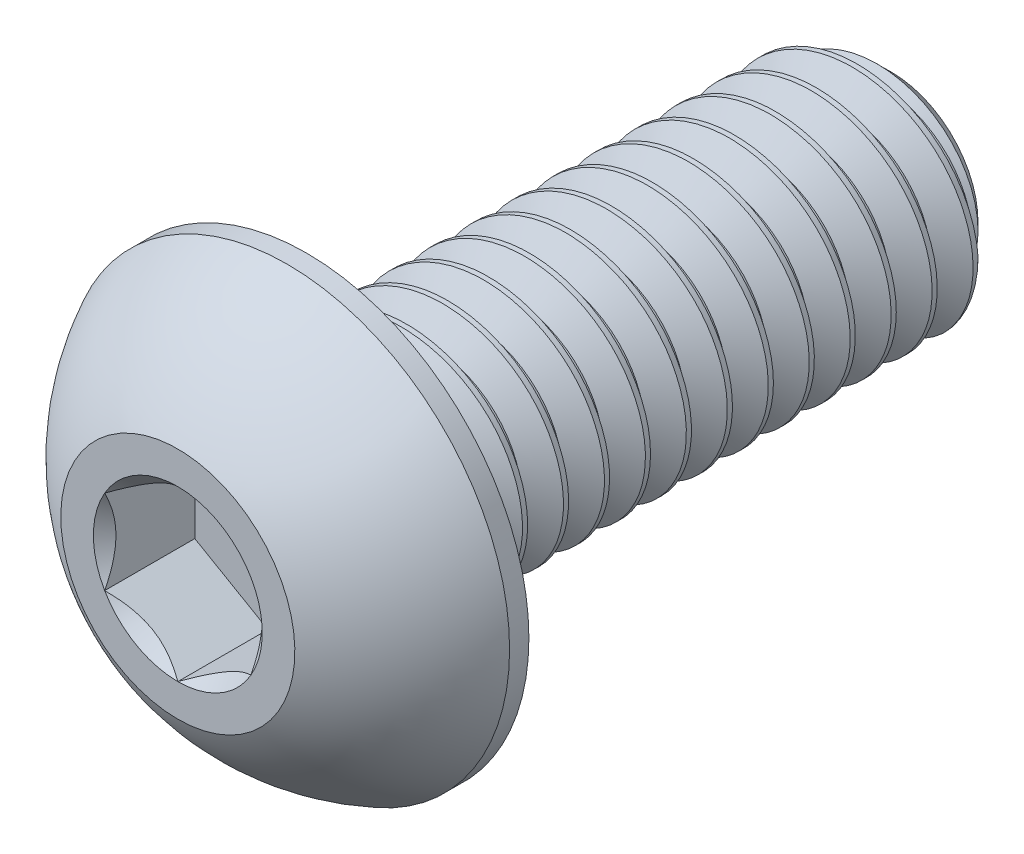
from build123d import *

# Parameters (mm, degrees)
SKETCH1_W          = 10
SKETCH1_H          = 2
CHAMFER1_SIZE      = 0.525
CUT_SWEEP1_PITCH   = 0.7
CUT_EXTRUDE2_DEPTH = 1.54


with BuildPart() as part:
    # Sketch1 → Revolve1 (revolve)
    with BuildSketch(Plane(origin=(0, 0, 0), x_dir=(0, 0, -1), z_dir=(1, 0, 0))):
        with Locations((7.2, 1)):
            Rectangle(SKETCH1_W, SKETCH1_H)
    revolve(axis=Axis((0, 0, -12.2), (0, 0, 1)))

    # Chamfer1
    chamfer1_edges = [part.edges().sort_by_distance(p)[0] for p in [
        (0, -2, -12.2),
    ]]
    chamfer(chamfer1_edges, length=CHAMFER1_SIZE)

    # Cut-Sweep1: the profile of Sketch2 profile screwed along a right-hand helix of 15.285714 turns, 6 arcs to a turn; built about Z, then put on its axis
    cut_sweep1_z = Axis((0, 0, 0), (0, 0, 1))
    cut_sweep1_corners = [(2.0003, 0, 0.000173205), (2.0003, 0, -0.612673205), (1.545336663, 0, -0.35), (1.545336663, 0, -0.2625)]
    with BuildLine(mode=Mode.PRIVATE) as cut_sweep1_profile:
        Line(cut_sweep1_corners[0], cut_sweep1_corners[1])
        Line(cut_sweep1_corners[1], cut_sweep1_corners[2])
        Line(cut_sweep1_corners[2], cut_sweep1_corners[3])
        Line(cut_sweep1_corners[3], cut_sweep1_corners[0])
    cut_sweep1_cap = Face(cut_sweep1_profile.wire())
    cut_sweep1_turn_angles = [0, 30, 60, 90, 120, 150, 180, 210, 240, 270, 300, 330, 360]
    cut_sweep1_turn_weights = [1, 0.8660254037844387, 1, 0.8660254037844387, 1, 0.8660254037844387, 1, 0.8660254037844387, 1, 0.8660254037844387, 1, 0.8660254037844387, 1]
    cut_sweep1_turn_rails = [Edge.make_bspline([Vector(p[0], p[1], 0).rotate(cut_sweep1_z, cut_sweep1_turn_angles[k]) / cut_sweep1_turn_weights[k] + Vector(0, 0, p[2] + CUT_SWEEP1_PITCH * cut_sweep1_turn_angles[k] / 360) for k in range(13)], [0, 0, 0, 1, 1, 2, 2, 3, 3, 4, 4, 5, 5, 6, 6, 6], 2, cut_sweep1_turn_weights) for p in cut_sweep1_corners]
    cut_sweep1_turn_sides = [Face.make_surface_from_curves(cut_sweep1_turn_rails[p[0]], cut_sweep1_turn_rails[p[1]]) for p in [(0, 1), (1, 2), (2, 3), (3, 0)]]
    cut_sweep1_last_angles = [5400, 5430, 5460, 5481.428571429, 5502.857142857]
    cut_sweep1_last_weights = [1, 0.8660254037844387, 1, 0.930873748644215, 1]
    cut_sweep1_last_rails = [Edge.make_bspline([Vector(p[0], p[1], 0).rotate(cut_sweep1_z, cut_sweep1_last_angles[k]) / cut_sweep1_last_weights[k] + Vector(0, 0, p[2] + CUT_SWEEP1_PITCH * cut_sweep1_last_angles[k] / 360) for k in range(5)], [0, 0, 0, 1, 1, 2, 2, 2], 2, cut_sweep1_last_weights) for p in cut_sweep1_corners]
    cut_sweep1_last_sides = [Face.make_surface_from_curves(cut_sweep1_last_rails[p[0]], cut_sweep1_last_rails[p[1]]) for p in [(0, 1), (1, 2), (2, 3), (3, 0)]]
    cut_sweep1 = Plane(origin=(0, 0, -12.2), x_dir=(0, 1, 0), z_dir=(0, 0, 1)) * Solid(Shell([*[p.moved(Location((0, 0, CUT_SWEEP1_PITCH * i))) for i in range(15) for p in cut_sweep1_turn_sides], *cut_sweep1_last_sides, cut_sweep1_cap, cut_sweep1_cap.rotate(cut_sweep1_z, 5502.857142857).moved(Location((0, 0, CUT_SWEEP1_PITCH * 5502.857142857 / 360)))]))
    add(cut_sweep1, mode=Mode.SUBTRACT)

    # Sketch7 → Revolve2 (revolve)
    with BuildSketch(Plane(origin=(0, 0, 0), x_dir=(0, 0, -1), z_dir=(1, 0, 0)), mode=Mode.PRIVATE) as revolve2_sk:
        with BuildLine():
            Line((1.87, 3.8), (2.2, 3.8))
            Line((2.2, 3.8), (2.2, 0))
            Line((2.2, 0), (0, 0))
            Line((0, 0), (0, 2))
            ThreePointArc((0, 2), (0.793500147, 3.047002626), (1.87, 3.8))
        make_face()
    revolve(revolve2_sk.sketch.rotate(Axis((0, 0, 0), (0, 0, -1)), 189.336081704), axis=Axis((0, 0, 0), (0, 0, -1)))

    # Sketch5 → Cut-Extrude2 (cut)
    with BuildSketch(Plane.XY):
        Polygon((1.25, -0.721687836), (1.25, 0.721687836), (0, 1.443375673), (-1.25, 0.721687836), (-1.25, -0.721687836), (0, -1.443375673), align=None)
    extrude(amount=-CUT_EXTRUDE2_DEPTH, mode=Mode.SUBTRACT)

    # Cut-Extrude3 cone 1 section (through the dimple's axis) → Cut-Extrude3 (revolve, cut)
    with BuildSketch(Plane(origin=(0, 0, 0), x_dir=(0, -1, 0), z_dir=(1, 0, 0))):
        Polygon((0, 0), (1.443375673, 0), (0, 1.443375673), align=None)
    revolve(axis=Axis((0, 0, 0), (0, 0, -1)), mode=Mode.SUBTRACT)


solid = part.part
